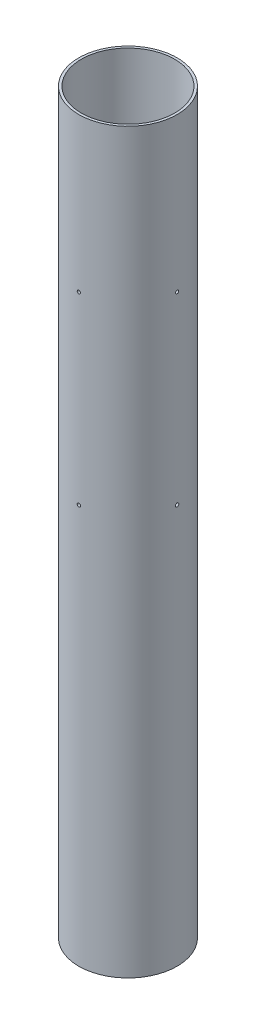
from build123d import *

# Parameters (mm, degrees)
SKETCH1_R                 = 50.8
SKETCH1_R_2               = 48.26
COUPLER_EXTRUSION_DEPTH   = 762
BULKHEAD_HOLE_REACH       = 772.42
SKETCH2_R                 = 1.6383
CIRPATTERN1_COUNT         = 4
LOWER_BULKHEAD_HOLE_REACH = 772.42
SKETCH3_R                 = 1.7526
CIRPATTERN2_COUNT         = 4


with BuildPart() as part:
    # Sketch1 → Coupler Extrusion (new body)
    with BuildSketch(Plane(origin=(0, 0, 0), x_dir=(1, 0, 0), z_dir=(0, 1, 0))):
        Circle(SKETCH1_R)
        Circle(SKETCH1_R_2, mode=Mode.SUBTRACT)
    extrude(amount=COUPLER_EXTRUSION_DEPTH)

    # Sketch2 → Bulkhead Hole (cut, up to next)
    with BuildSketch(Plane.XY.offset(50.8), mode=Mode.PRIVATE) as bulkhead_hole_sk1:
        with Locations((0, 603.25)):
            Circle(SKETCH2_R)
    bulkhead_hole_tool1 = extrude(bulkhead_hole_sk1.sketch, amount=-BULKHEAD_HOLE_REACH, mode=Mode.PRIVATE) & part.part
    bulkhead_hole = bulkhead_hole_tool1.solids().sort_by_distance((0, 603.25, 50.8))[0]
    add(bulkhead_hole, mode=Mode.SUBTRACT)

    # CirPattern1: Bulkhead Hole ×4 about axis
    cirpattern1_axis = Axis((0, 762, 0), (0, -1, 0))
    for i in range(1, CIRPATTERN1_COUNT):
        add(bulkhead_hole.rotate(cirpattern1_axis, i * 360 / CIRPATTERN1_COUNT), mode=Mode.SUBTRACT)

    # Sketch3 → Lower Bulkhead Hole (cut, up to next)
    with BuildSketch(Plane.XY.offset(50.8), mode=Mode.PRIVATE) as lower_bulkhead_hole_sk1:
        with Locations((0, 412.75)):
            Circle(SKETCH3_R)
    lower_bulkhead_hole_tool1 = extrude(lower_bulkhead_hole_sk1.sketch, amount=-LOWER_BULKHEAD_HOLE_REACH, mode=Mode.PRIVATE) & part.part
    lower_bulkhead_hole = lower_bulkhead_hole_tool1.solids().sort_by_distance((0, 412.75, 50.8))[0]
    add(lower_bulkhead_hole, mode=Mode.SUBTRACT)

    # CirPattern2: Lower Bulkhead Hole ×4 about axis
    cirpattern2_axis = Axis((0, 762, 0), (0, -1, 0))
    for i in range(1, CIRPATTERN2_COUNT):
        add(lower_bulkhead_hole.rotate(cirpattern2_axis, i * 360 / CIRPATTERN2_COUNT), mode=Mode.SUBTRACT)


solid = part.part
